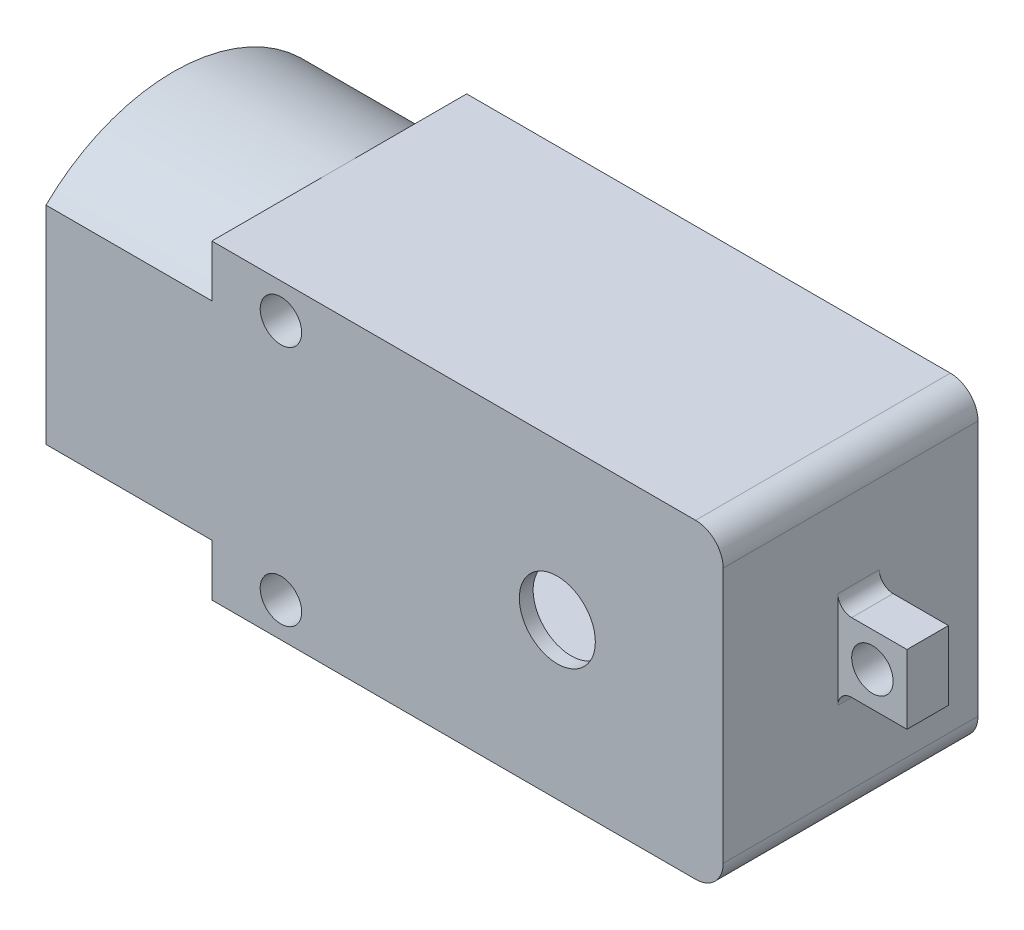
from build123d import *

# Parameters (mm, degrees)
SKETCH1_R                = 1.5
BOSS_EXTRUDE1_DEPTH      = 9.22
BOSS_EXTRUDE2_DEPTH      = 12
SHELL1_START             = -10
SHELL1_OUTLINE_W         = 20.5
SHELL1_OUTLINE_H         = 16.44
SHELL1_DEPTH             = 27.5
SHELL1_START_2           = -29.5
SHELL1_2_DEPTH           = 14.5
SHELL1_START_3           = -16.5
SHELL1_3_DEPTH           = 1.5
SHELL1_START_4           = -8.22
SHELL1_4_DEPTH           = 16.44
SKETCH3_R                = 1.5
BOSS_EXTRUDE3_DEPTH      = 1
BOSS_EXTRUDE4_DEPTH      = 1.5
BOSS_EXTRUDE4_DEPTH_BACK = 1.5
SKETCH6_W                = 5
SKETCH6_H                = 5
SKETCH6_R                = 1.5
SKETCH7_R                = 2.75
CUT_EXTRUDE1_DEPTH       = 37.562906066
FILLET1_R                = 1


with BuildPart() as part:
    # Sketch1 → Boss-Extrude1 (new, symmetric)
    with BuildSketch(Plane.XY):
        with BuildLine():
            Line((17.5, -11.25), (-17.5, -11.25))
            Line((-17.5, -11.25), (-17.5, 11.25))
            Line((-17.5, 11.25), (17.5, 11.25))
            ThreePointArc((17.5, 11.25), (18.914213562, 10.664213562), (19.5, 9.25))
            Line((19.5, 9.25), (19.5, -9.25))
            ThreePointArc((19.5, -9.25), (18.914213562, -10.664213562), (17.5, -11.25))
        make_face()
        with Locations((-12.5, 8.75)):
            Circle(SKETCH1_R, mode=Mode.SUBTRACT)
        with Locations((-12.5, -8.75)):
            Circle(SKETCH1_R, mode=Mode.SUBTRACT)
    extrude(amount=BOSS_EXTRUDE1_DEPTH, both=True)

    # Sketch2 → Boss-Extrude2 (add)
    with BuildSketch(Plane.ZY.offset(17.5)):
        with BuildLine():
            Line((9.22, -7.5), (9.22, 7.5))
            ThreePointArc((9.22, 7.5), (0, 11.25), (-9.22, 7.5))
            Line((-9.22, 7.5), (-9.22, -7.5))
            ThreePointArc((-9.22, -7.5), (0, -11.25), (9.22, -7.5))
        make_face()
    extrude(amount=BOSS_EXTRUDE2_DEPTH)

    # Shell1: read off the stored shape, not the designer's step
    # Shell1 outline → Shell1 (cut)
    with BuildSketch(Plane.YZ.offset(SHELL1_START)):
        Rectangle(SHELL1_OUTLINE_W, SHELL1_OUTLINE_H)
    extrude(amount=SHELL1_DEPTH, mode=Mode.SUBTRACT)

    # Shell1 2 outline → Shell1 2 (cut)
    with BuildSketch(Plane.YZ.offset(SHELL1_START_2)):
        with BuildLine():
            ThreePointArc((7.068411902, -8.22), (10.25, 0), (7.068411902, 8.22))
            Line((7.068411902, 8.22), (-7.068411902, 8.22))
            ThreePointArc((-7.068411902, 8.22), (-10.25, 0), (-7.068411902, -8.22))
            Line((-7.068411902, -8.22), (7.068411902, -8.22))
        make_face()
    extrude(amount=SHELL1_2_DEPTH, mode=Mode.SUBTRACT)

    # Shell1 3 outline → Shell1 3 (cut)
    with BuildSketch(Plane.YZ.offset(SHELL1_START_3)):
        with BuildLine():
            Line((10.25, 0), (10.25, 8.22))
            Line((10.25, 8.22), (7.068411902, 8.22))
            ThreePointArc((7.068411902, 8.22), (9.426855331, 4.407122157), (10.25, 0))
        make_face()
        with BuildLine():
            Line((10.25, -8.22), (10.25, 0))
            ThreePointArc((10.25, 0), (9.426855331, -4.407122157), (7.068411902, -8.22))
            Line((7.068411902, -8.22), (10.25, -8.22))
        make_face()
        with BuildLine():
            ThreePointArc((-10.25, 0), (-9.426855331, 4.407122157), (-7.068411902, 8.22))
            Line((-7.068411902, 8.22), (-10.25, 8.22))
            Line((-10.25, 8.22), (-10.25, 0))
        make_face()
        with BuildLine():
            Line((-10.25, -8.22), (-7.068411902, -8.22))
            ThreePointArc((-7.068411902, -8.22), (-9.426855331, -4.407122157), (-10.25, 0))
            Line((-10.25, 0), (-10.25, -8.22))
        make_face()
    extrude(amount=SHELL1_3_DEPTH, mode=Mode.SUBTRACT)

    # Shell1 4 outline → Shell1 4 (cut)
    with BuildSketch(Plane.XY.offset(SHELL1_START_4)):
        with BuildLine():
            ThreePointArc((-14.5, -10.25), (-14.871708245, -9.540569415), (-15, -8.75))
            Line((-15, -8.75), (-15, -10.25))
            Line((-15, -10.25), (-14.5, -10.25))
        make_face()
        with BuildLine():
            ThreePointArc((-10, 8.75), (-12.499999993, 6.25), (-15, 8.749999987))
            Line((-15, 8.749999987), (-15, -8.75))
            ThreePointArc((-15, -8.75), (-12.5, -6.25), (-10, -8.75))
            Line((-10, -8.75), (-10, 8.75))
        make_face()
        with BuildLine():
            Line((-14.5, 10.25), (-15, 10.25))
            Line((-15, 10.25), (-15, 8.749999987))
            ThreePointArc((-15, 8.749999987), (-14.871708247, 9.540569409), (-14.5, 10.25))
        make_face()
        with BuildLine():
            ThreePointArc((-10.5, 10.25), (-10.128291755, 9.540569415), (-10, 8.75))
            Line((-10, 8.75), (-10, 10.25))
            Line((-10, 10.25), (-10.5, 10.25))
        make_face()
        with BuildLine():
            Line((-10, -10.25), (-10, -8.75))
            ThreePointArc((-10, -8.75), (-10.128291755, -9.540569415), (-10.5, -10.25))
            Line((-10.5, -10.25), (-10, -10.25))
        make_face()
        with BuildLine():
            ThreePointArc((18.5, 9.25), (18.207106781, 9.957106781), (17.5, 10.25))
            Line((17.5, 10.25), (17.5, -10.25))
            ThreePointArc((17.5, -10.25), (18.207106781, -9.957106781), (18.5, -9.25))
            Line((18.5, -9.25), (18.5, 9.25))
        make_face()
    extrude(amount=SHELL1_4_DEPTH, mode=Mode.SUBTRACT)

    # Sketch3 → Boss-Extrude3 (add)
    with BuildSketch(Plane.ZY.offset(17.5)):
        with BuildLine():
            Line((-9.22, 7.5), (-9.22, -7.5))
            ThreePointArc((-9.22, -7.5), (0, -11.25), (9.22, -7.5))
            Line((9.22, -7.5), (9.22, 7.5))
            ThreePointArc((9.22, 7.5), (0, 11.25), (-9.22, 7.5))
        make_face()
        Circle(SKETCH3_R, mode=Mode.SUBTRACT)
    extrude(amount=BOSS_EXTRUDE3_DEPTH)

    # Sketch6 → Boss-Extrude4 (add, two sides: drawn at the far end of the back side and taken through both)
    with BuildSketch(Plane.XY.offset(-0.58).offset(-BOSS_EXTRUDE4_DEPTH_BACK)):
        with Locations((22, 0)):
            Rectangle(SKETCH6_W, SKETCH6_H)
        with Locations((22, 0)):
            Circle(SKETCH6_R, mode=Mode.SUBTRACT)
    extrude(amount=BOSS_EXTRUDE4_DEPTH + BOSS_EXTRUDE4_DEPTH_BACK)

    # Sketch7 → Cut-Extrude1 (cut, through all)
    with BuildSketch(Plane.XY.offset(9.22)):
        with Locations((7.5, 0)):
            Circle(SKETCH7_R)
    extrude(amount=-CUT_EXTRUDE1_DEPTH, mode=Mode.SUBTRACT)

    # Fillet1
    fillet1_edges = [part.edges().sort_by_distance(p)[0] for p in [
        (19.5, 2.5, -0.58),
        (19.5, -2.5, -0.58),
    ]]
    fillet(fillet1_edges, radius=FILLET1_R)


solid = part.part
